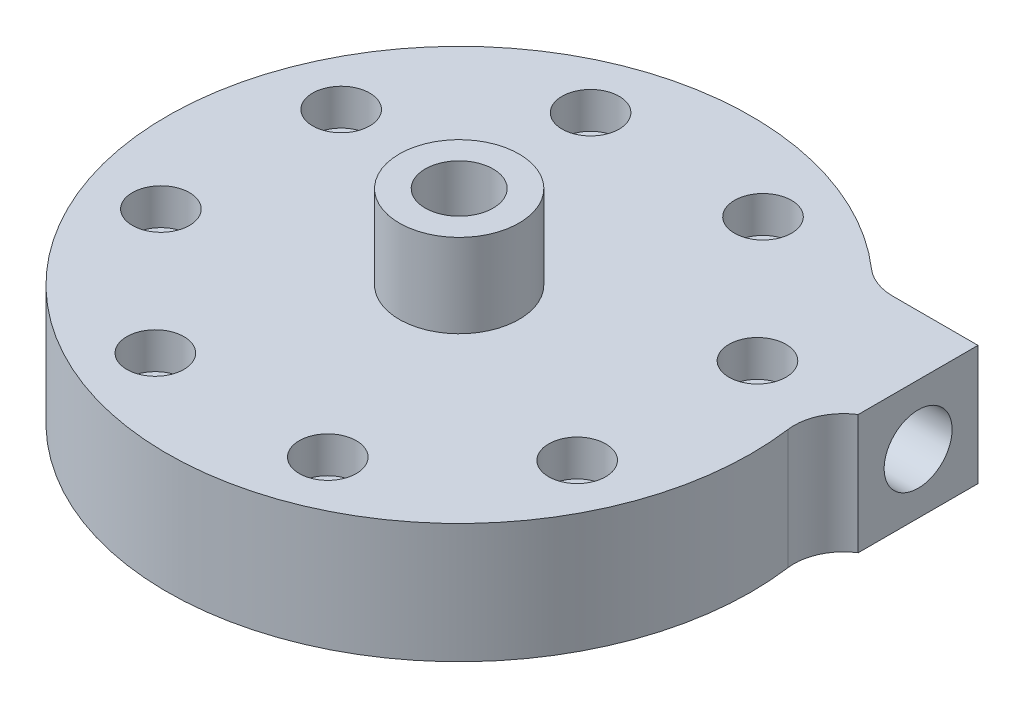
from build123d import *

# Parameters (mm, degrees)
MAIN_BODY_DEPTH           = 23.096875
SKETCH7_R                 = 25.4
INLET_BOSS_DEPTH          = 50.8
SKETCH5_R                 = 2.9765625
BOLT_CLEARANCES_DEPTH     = 86.584352336
SKETCH6_R                 = 5.5
BOLT_HEAD_CLEARANCE_DEPTH = 7


with BuildPart() as part:
    # Sketch1 → main body (new body)
    with BuildSketch(Plane(origin=(0, 0, 0), x_dir=(1, 0, 0), z_dir=(0, 1, 0))):
        with BuildLine():
            Line((60.126440201, 28.3845), (60.126440201, 39.9329375))
            Line((60.126440201, 39.9329375), (43.701872576, 39.9329375))
            ThreePointArc((43.701872576, 39.9329375), (40.184045696, 40.572120546), (37.115925876, 42.407958692))
            ThreePointArc((37.115925876, 42.407958692), (-49.641429542, -26.678744106), (55.847763546, 7.553424452))
            ThreePointArc((55.847763546, 7.553424452), (56.636518206, 12.817272415), (60.126440201, 16.8360625))
            Line((60.126440201, 16.8360625), (60.126440201, 28.3845))
        make_face()
    extrude(amount=MAIN_BODY_DEPTH)

    # Sketch7 → inlet boss (add)
    with BuildSketch(Plane(origin=(0, 23.096875, 0), x_dir=(1, 0, 0), z_dir=(0, 1, 0))):
        Circle(SKETCH7_R)
    extrude(amount=INLET_BOSS_DEPTH)

    # Sketch3 → expansion cone and outlet (revolve, cut)
    with BuildSketch(Plane(origin=(0, 11.5484375, 0), x_dir=(1, 0, 0), z_dir=(0, 1, 0))):
        Polygon((21.116967457, 30.6705), (0, 30.6705), (0, 28.3845), (2.48332197, 28.3845), (50.126440201, 28.3845), (60.126440201, 28.3845), (60.126440201, 34.9329375), (50.126440201, 34.9329375), (50.126440201, 33.2085), align=None)
    revolve(axis=Axis((50.126440201, 11.5484375, -28.3845), (-1, 0, 0)), mode=Mode.SUBTRACT)

    # Sketch2 → main chamber (revolve, cut)
    with BuildSketch(Plane.XY):
        Polygon((0, 18.681711844), (0, 9.093599728), (0, 6.593599728), (0, 0), (30.6705, 0), (30.6705, 6.593599728), (30.6705, 13.323267203), (30.6705, 13.8344375), (5.461, 19.192882141), (5.461, 29.192882141), (6.5484375, 29.192882141), (6.5484375, 39.192882141), (11.5484375, 39.192882141), (11.5484375, 23.096875), (25.4, 23.096875), (25.4, 73.896875), (0, 73.896875), (0, 39.192882141), (0, 19.192882141), align=None)
    revolve(axis=Axis((0, 18.681711844, 0), (0, -1, 0)), mode=Mode.SUBTRACT)

    # Sketch5 → bolt clearances (cut, through all)
    with BuildSketch(Plane(origin=(0, 23.096875, 0), x_dir=(1, 0, 0), z_dir=(0, 1, 0))):
        with Locations((41.435066256, 16.091543876)):
            Circle(SKETCH5_R)
        with Locations((40.677456124, -17.920576534)):
            Circle(SKETCH5_R)
        with Locations((16.091543876, -41.435066256)):
            Circle(SKETCH5_R)
        with Locations((-17.920576534, -40.677456124)):
            Circle(SKETCH5_R)
        with Locations((-41.435066256, -16.091543876)):
            Circle(SKETCH5_R)
        with Locations((-40.677456124, 17.920576534)):
            Circle(SKETCH5_R)
        with Locations((-16.091543876, 41.435066256)):
            Circle(SKETCH5_R)
        with Locations((17.920576534, 40.677456124)):
            Circle(SKETCH5_R)
    extrude(amount=-BOLT_CLEARANCES_DEPTH, mode=Mode.SUBTRACT)

    # Sketch6 → bolt head clearance (cut)
    with BuildSketch(Plane(origin=(0, 23.096875, 0), x_dir=(1, 0, 0), z_dir=(0, 1, 0))):
        with Locations((41.435066256, 16.091543876)):
            Circle(SKETCH6_R)
        with Locations((40.677456124, -17.920576534)):
            Circle(SKETCH6_R)
        with Locations((16.091543876, -41.435066256)):
            Circle(SKETCH6_R)
        with Locations((-17.920576534, -40.677456124)):
            Circle(SKETCH6_R)
        with Locations((-41.435066256, -16.091543876)):
            Circle(SKETCH6_R)
        with Locations((-40.677456124, 17.920576534)):
            Circle(SKETCH6_R)
        with Locations((-16.091543876, 41.435066256)):
            Circle(SKETCH6_R)
        with Locations((17.920576534, 40.677456124)):
            Circle(SKETCH6_R)
    extrude(amount=-BOLT_HEAD_CLEARANCE_DEPTH, mode=Mode.SUBTRACT)


solid = part.part
